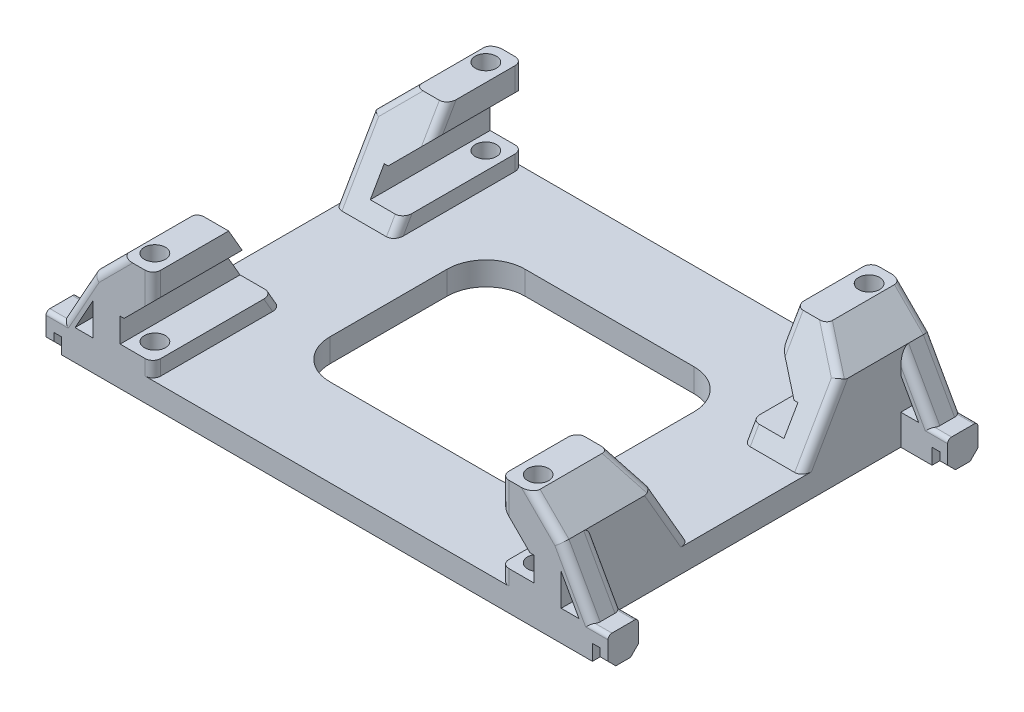
from build123d import *

# Parameters (mm, degrees)
BOSS_EXTRUDE1_DEPTH  = 46.39999966
SKETCH2_R            = 1.35
CUT_EXTRUDE1_DEPTH   = 57.705554564
CUT_EXTRUDE2_DEPTH   = 57.705554564
CUT_EXTRUDE3_DEPTH   = 77.912417193
MOVE_FACE1_BY        = 0.5
MOVE_FACE1_2_BY      = 0.5
SKETCH9_W            = 31.645569848
SKETCH9_H            = 25
CUT_EXTRUDE7_DEPTH   = 58.115408763
CUT_EXTRUDE5_DEPTH   = 0.5
CUT_EXTRUDE6_DEPTH   = 0.5
MOVE_START           = 2.95
MOVE_FACE2_OUTLINE_W = 4.2
MOVE_FACE2_OUTLINE_H = 47.39999966
MOVE_FACE2_OUTLINE_R = 1.35
MOVE_FACE2_DEPTH     = 2
MOVE_FACE3_BY        = 2
SKETCH10_W           = 3.889087297
SKETCH10_H           = 3.889087297
BOSS_EXTRUDE2_DEPTH  = 6
SKETCH11_W           = 1
SKETCH11_H           = 3.889087297
CUT_EXTRUDE8_DEPTH   = 1
CHAMFER1_SIZE        = 1
BOSS_EXTRUDE3_DEPTH  = 3.889087297
MIRROR3_2_ANGLE      = 180
FILLET1_R            = 5
FILLET2_R            = 1
FILLET3_R            = 0.5


with BuildPart() as part:
    # Sketch1 → Boss-Extrude1 (new body)
    with BuildSketch(Plane.XY):
        Polygon((0, 0), (30, 0), (30, 12.7499), (22.3001, 12.7499), (22.3001, 9.7499), (26, 6.05), (26, 4.95), (22.3, 4.95), (22.3, 1), (0, 1), align=None)
    extrude(amount=-BOSS_EXTRUDE1_DEPTH)

    # Mirror1: part across plane


with BuildPart() as part_1:
    add(part.part)
    add(part.part.mirror(Plane(origin=(0, 1, -46.39999966), x_dir=(0, 0, 1), z_dir=(-1, 0, 0))))

    # Sketch2 → Cut-Extrude1 (cut, through all)
    with BuildSketch(Plane(origin=(0, 12.7499, 0), x_dir=(1, 0, 0), z_dir=(0, 1, 0))):
        with Locations(Location((-24.549999831, 1.999999999, 0), (0, 0, 270))):
            Circle(SKETCH2_R)
        with Locations(Location((-24.549999831, 44.399999661, 0), (0, 0, 270))):
            Circle(SKETCH2_R)
        with Locations(Location((24.549999831, 1.999999999, 0), (0, 0, 270))):
            Circle(SKETCH2_R)
        with Locations(Location((24.549999831, 44.399999661, 0), (0, 0, 270))):
            Circle(SKETCH2_R)
    extrude(amount=-CUT_EXTRUDE1_DEPTH, mode=Mode.SUBTRACT)

    # Sketch3 → Cut-Extrude2 (cut, through all)
    with BuildSketch(Plane.XY):
        Polygon((26.3, 12.7499), (30, 9.0499), (30, 12.7499), align=None)
        Polygon((-30, 12.7499), (-30, 9.0499), (-26.3, 12.7499), align=None)
    extrude(amount=-CUT_EXTRUDE2_DEPTH, mode=Mode.SUBTRACT)

    # Sketch4 → Cut-Extrude3 (cut, through all)
    with BuildSketch(Plane(origin=(30, 0, 0), x_dir=(0, 0, -1), z_dir=(1, 0, 0))):
        Polygon((9.19999983, 12.7499), (37.19999983, 12.7499), (30.416191902, 1), (15.983807758, 1), align=None)
    extrude(amount=-CUT_EXTRUDE3_DEPTH, mode=Mode.SUBTRACT)

    # Move Face1: a face moved outward by 0.5
    extrude(part_1.faces().sort_by_distance((-24, 3.187475, -46.39999966))[0], amount=MOVE_FACE1_BY, dir=(0, 0, -1))

    # Move Face1 2: a face moved outward by 0.5
    extrude(part_1.faces().sort_by_distance((-24, 3.187475, 0))[0], amount=MOVE_FACE1_2_BY, dir=(0, 0, 1))

    # Sketch9 → Cut-Extrude7 (cut, through all)
    with BuildSketch(Plane.XZ):
        with Locations((0, -23.19999983)):
            Rectangle(SKETCH9_W, SKETCH9_H)
    extrude(amount=-CUT_EXTRUDE7_DEPTH, mode=Mode.SUBTRACT)

    # Sketch6 → Cut-Extrude5 (cut)
    with BuildSketch(Plane(origin=(-26, 0, 0), x_dir=(0, 0, -1), z_dir=(1, 0, 0))):
        Polygon((13.703274195, 4.95), (13.068188899, 6.05), (-0.5, 6.05), (-0.5, 4.95), align=None)
        Polygon((33.331810761, 6.05), (32.696725465, 4.95), (46.89999966, 4.95), (46.89999966, 6.05), align=None)
    extrude(amount=-CUT_EXTRUDE5_DEPTH, mode=Mode.SUBTRACT)

    # Sketch7 → Cut-Extrude6 (cut)
    with BuildSketch(Plane.ZY.offset(-26)):
        Polygon((-13.068188899, 6.05), (-13.703274195, 4.95), (0.5, 4.95), (0.5, 6.05), align=None)
        Polygon((-32.696725465, 4.95), (-33.331810761, 6.05), (-46.89999966, 6.05), (-46.89999966, 4.95), align=None)
    extrude(amount=-CUT_EXTRUDE6_DEPTH, mode=Mode.SUBTRACT)

    # Move Face2: read off the stored shape, not the designer's step
    # Move Face2 outline → Move Face2 (cut)
    # profile 1 of 2: a face of its own
    with BuildSketch(Plane(origin=(0, 0, 0), x_dir=(1, 0, 0), z_dir=(0, 1, 0)).offset(MOVE_START)):
        with Locations((-24.4, 23.19999983)):
            Rectangle(MOVE_FACE2_OUTLINE_W, MOVE_FACE2_OUTLINE_H)
        with Locations((-24.549999831, 1.999999999)):
            Circle(MOVE_FACE2_OUTLINE_R, mode=Mode.SUBTRACT)
        with Locations((-24.549999831, 44.399999661)):
            Circle(MOVE_FACE2_OUTLINE_R, mode=Mode.SUBTRACT)
    # profile 2 of 2: a face of its own
    with BuildSketch(Plane(origin=(0, 0, 0), x_dir=(1, 0, 0), z_dir=(0, 1, 0)).offset(MOVE_START)):
        with Locations((24.4, 23.19999983)):
            Rectangle(MOVE_FACE2_OUTLINE_W, MOVE_FACE2_OUTLINE_H)
        with Locations((24.549999831, 1.999999999)):
            Circle(MOVE_FACE2_OUTLINE_R, mode=Mode.SUBTRACT)
        with Locations((24.549999831, 44.399999661)):
            Circle(MOVE_FACE2_OUTLINE_R, mode=Mode.SUBTRACT)
    extrude(amount=MOVE_FACE2_DEPTH, mode=Mode.SUBTRACT)

    # Move Face3: a face moved outward by 2.0
    extrude(part_1.faces().sort_by_distance((0, 0, -42.159999694))[0], amount=MOVE_FACE3_BY, dir=(0, -1, 0))


with BuildPart() as body_2:
    # Sketch10 → Boss-Extrude2 (new body)
    with BuildSketch(Plane(origin=(30, 0, -16.89999966), x_dir=(0, 0, 1), z_dir=(-1, 0, 0))):
        with Locations((-28.055456352, -0.055456351)):
            Rectangle(SKETCH10_W, SKETCH10_H)
    extrude(amount=-BOSS_EXTRUDE2_DEPTH)

    # Sketch11 → Cut-Extrude8 (cut)
    with BuildSketch(Plane(origin=(0, -2, 0), x_dir=(1, 0, 0), z_dir=(0, 1, 0))):
        with Locations((34.5, 44.955456012)):
            Rectangle(SKETCH11_W, SKETCH11_H)
    extrude(amount=CUT_EXTRUDE8_DEPTH, mode=Mode.SUBTRACT)

    # Chamfer1
    chamfer1_edges = [body_2.edges().sort_by_distance(p)[0] for p in [
        (34.5, -1, -43.010912363),
        (34.5, -1, -46.89999966),
        (35.5, -2, -43.010912363),
        (35.5, -2, -46.89999966),
    ]]
    chamfer(chamfer1_edges, length=CHAMFER1_SIZE - 0.0001)  # a hair under: the kernel refuses the full size

    # Sketch12 → Boss-Extrude3 (add)
    with BuildSketch(Plane(origin=(0, 0, -46.89999966), x_dir=(-1, 0, 0), z_dir=(0, 0, -1))):
        Polygon((-30, 9.0499), (-34, 1.889087297), (-32.281842298, 1.889087297), (-30, 5.974048626), align=None)
    extrude(amount=-BOSS_EXTRUDE3_DEPTH)


with BuildPart() as body_3:
    # Mirror3: read off the stored shape, not the designer's step
    # Mirror3: mirrored copy
    add(body_2.part.mirror(Plane.XY.offset(-23.19999983)))


with BuildPart() as body_4:
    # Mirror3 2: copy of body 2
    add(body_2.part.moved(Location((0, 0, 46.3999997))).rotate(Axis((0, 0, 0), (0, 1, 0)), MIRROR3_2_ANGLE))


with BuildPart() as body_5:
    # Mirror3 3: mirrored copy
    add(body_2.part.mirror(Plane.YZ))

    # Combine1: union part, body 4, body 2, body 3
    add(part_1.part)
    add(body_4.part)
    add(body_2.part)
    add(body_3.part)

    # Fillet1
    fillet1_edges = [body_5.edges().sort_by_distance(p)[0] for p in [
        (-15.822784924, -0.5, -10.69999983),
        (15.822784924, -0.5, -10.69999983),
        (15.822784924, -0.5, -35.69999983),
        (-15.822784924, -0.5, -35.69999983),
    ]]
    fillet(fillet1_edges, radius=FILLET1_R)

    # Fillet2
    fillet2_edges = [body_5.edges().sort_by_distance(p)[0] for p in [
        (-30, 5.02495, -13.660001792),
        (-30, 5.02495, -32.739997868),
        (-22.3, 1.975, 0.5),
        (-22.3001, 11.2499, 0.5),
        (-28.15, 10.8999, -10.268097828),
        (-28.15, 10.8999, 0.5),
        (28.15, 10.8999, -10.268097828),
        (28.15, 10.8999, 0.5),
        (22.3, 1.975, -46.89999966),
        (22.3001, 11.2499, -46.89999966),
        (28.15, 10.8999, -46.89999966),
        (32, 5.469493648, -46.89999966),
        (-28.15, 10.8999, -46.89999966),
        (-22.3001, 11.2499, -46.89999966),
        (-22.3, 1.975, -46.89999966),
        (22.3, 1.975, 0.5),
        (-32, 5.469493648, 0.49999996),
        (22.3001, 11.2499, 0.5),
        (-28.15, 10.8999, -36.131901832),
        (28.15, 10.8999, -36.131901832),
        (22.3001, 11.2499, -10.066025234),
        (30, 5.02495, -13.660001792),
        (22.3, 1.975, -15.420891245),
        (22.3, 1.975, -30.979108415),
        (30, 5.02495, -32.739997868),
        (22.3001, 11.2499, -36.333974426),
        (-22.3, 1.975, -15.420891245),
        (-22.3001, 11.2499, -36.333974426),
        (-22.3, 1.975, -30.979108415),
        (-32, 5.469493648, -3.389087337),
        (32, 5.469493648, -43.010912363),
        (32, 5.469493648, -3.389087297),
        (32, 5.469493648, 0.5),
        (-32, 5.469493648, -46.89999966),
        (-32, 5.469493648, -43.010912363),
    ]]
    fillet(fillet2_edges, radius=FILLET2_R)

    # Fillet3
    fillet3_edges = [body_5.edges().sort_by_distance(p)[0] for p in [
        (34.427280766, 1.889087297, 0.5),
        (-34.427280766, 1.889087297, -3.389087337),
        (-35, 1.889087297, 0.49999996),
        (34.427280766, 1.889087297, -43.010912363),
        (34.427280766, 1.889087297, -46.89999966),
        (34.427280766, 1.889087297, -3.389087297),
        (-34.427280766, 1.889087297, -46.89999966),
        (-34.427280766, 1.889087297, -43.010912363),
    ]]
    fillet(fillet3_edges, radius=FILLET3_R)


solid = body_5.part
